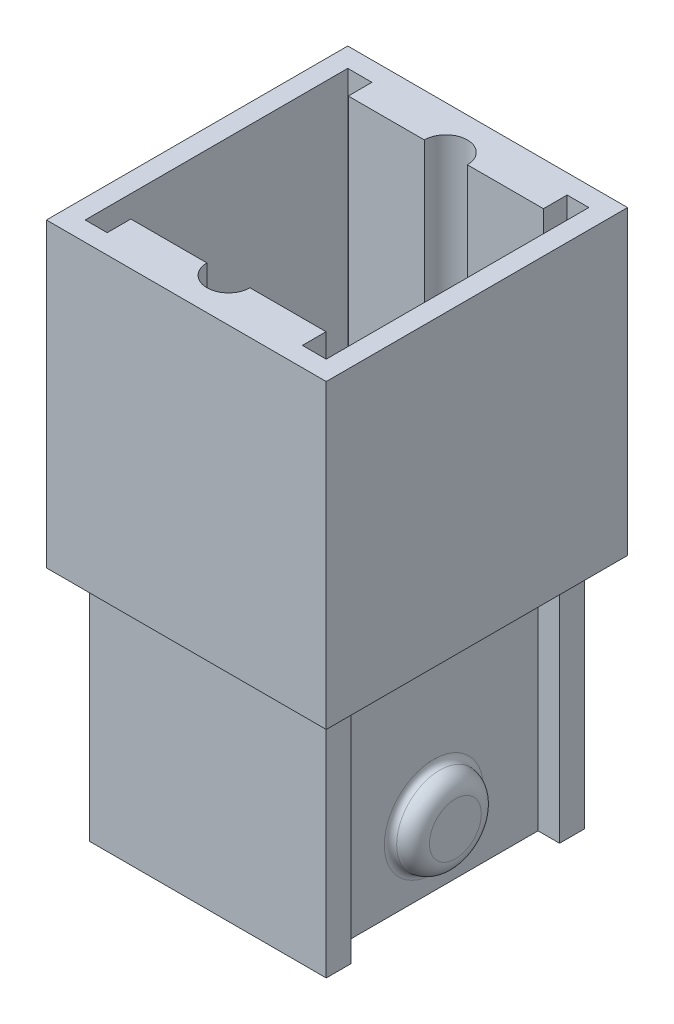
from build123d import *

# Parameters (mm, degrees)
SKETCH1_W           = 5.5
SKETCH1_H           = 6
BOSS_EXTRUDE1_DEPTH = 12.5
SKETCH2_W           = 0.5
SKETCH2_H           = 4.84
CUT_EXTRUDE1_DEPTH  = 12.5
SKETCH3_R           = 1
BOSS_EXTRUDE2_DEPTH = 0.5
FILLET1_R           = 0.15
FILLET2_R           = 0.4
SKETCH4_R           = 1
BOSS_EXTRUDE3_DEPTH = 0.5
FILLET3_R           = 0.1
FILLET4_R           = 0.4
SKETCH5_W           = 6.5
SKETCH5_H           = 7
BOSS_EXTRUDE5_DEPTH = 7
CUT_EXTRUDE4_DEPTH  = 6
SKETCH8_R           = 0.5
CUT_EXTRUDE5_DEPTH  = 6


with BuildPart() as part:
    # Sketch1 → Boss-Extrude1 (new body)
    with BuildSketch(Plane(origin=(0, 0, 0), x_dir=(1, 0, 0), z_dir=(0, 1, 0))):
        with Locations((2.75, 3)):
            Rectangle(SKETCH1_W, SKETCH1_H)
    extrude(amount=BOSS_EXTRUDE1_DEPTH)

    # Sketch2 → Cut-Extrude1 (cut)
    with BuildSketch(Plane(origin=(0, 12.5, 0), x_dir=(1, 0, 0), z_dir=(0, 1, 0))):
        with Locations((0.25, 3)):
            Rectangle(SKETCH2_W, SKETCH2_H)
        with Locations((5.25, 3)):
            Rectangle(SKETCH2_W, SKETCH2_H)
    extrude(amount=-CUT_EXTRUDE1_DEPTH, mode=Mode.SUBTRACT)

    # Sketch3 → Boss-Extrude2 (add)
    with BuildSketch(Plane(origin=(5, 0, 0), x_dir=(0, 0, -1), z_dir=(1, 0, 0))):
        with Locations(Location((3, 1.5, 0), (0, 0, 180))):
            Circle(SKETCH3_R)
    extrude(amount=BOSS_EXTRUDE2_DEPTH)

    # Fillet1
    fillet1_edges = [part.edges().sort_by_distance(p)[0] for p in [
        (5, 1.5, -4),
    ]]
    fillet(fillet1_edges, radius=FILLET1_R)

    # Fillet2
    fillet2_edges = [part.edges().sort_by_distance(p)[0] for p in [
        (5.5, 1.5, -4),
    ]]
    fillet(fillet2_edges, radius=FILLET2_R)

    # Sketch4 → Boss-Extrude3 (add)
    with BuildSketch(Plane.ZY.offset(-0.5)):
        with Locations(Location((-3.017081324, 1.5, 0), (0, 0, 180))):
            Circle(SKETCH4_R)
    extrude(amount=BOSS_EXTRUDE3_DEPTH)

    # Fillet3
    fillet3_edges = [part.edges().sort_by_distance(p)[0] for p in [
        (0.5, 1.5, -2.017081324),
    ]]
    fillet(fillet3_edges, radius=FILLET3_R)

    # Fillet4
    fillet4_edges = [part.edges().sort_by_distance(p)[0] for p in [
        (0, 1.5, -2.017081324),
    ]]
    fillet(fillet4_edges, radius=FILLET4_R - 0.0001)  # a hair under: the kernel refuses the full size

    # Sketch5 → Boss-Extrude5 (add)
    with BuildSketch(Plane(origin=(0, 12.5, 0), x_dir=(1, 0, 0), z_dir=(0, 1, 0))):
        with Locations((2.75, 3)):
            Rectangle(SKETCH5_W, SKETCH5_H)
    extrude(amount=-BOSS_EXTRUDE5_DEPTH)

    # Sketch7 → Cut-Extrude4 (cut)
    with BuildSketch(Plane(origin=(0, 12.5, 0), x_dir=(1, 0, 0), z_dir=(0, 1, 0))):
        Polygon((-0.05, -0.05), (0.461663349, -0.05), (0.461663349, 0.5), (4.995729898, 0.5), (4.995729898, -0.05), (5.55, -0.05), (5.55, 6.05), (5.045729898, 6.05), (5.045729898, 5.5), (0.511663349, 5.5), (0.511663349, 6.05), (-0.05, 6.05), align=None)
    extrude(amount=-CUT_EXTRUDE4_DEPTH, mode=Mode.SUBTRACT)

    # Sketch8 → Cut-Extrude5 (cut)
    with BuildSketch(Plane(origin=(0, 12.5, 0), x_dir=(1, 0, 0), z_dir=(0, 1, 0))):
        with Locations((2.778696624, 5.5)):
            Circle(SKETCH8_R)
        with Locations((2.728696624, 0.5)):
            Circle(SKETCH8_R)
    extrude(amount=-CUT_EXTRUDE5_DEPTH, mode=Mode.SUBTRACT)


solid = part.part
